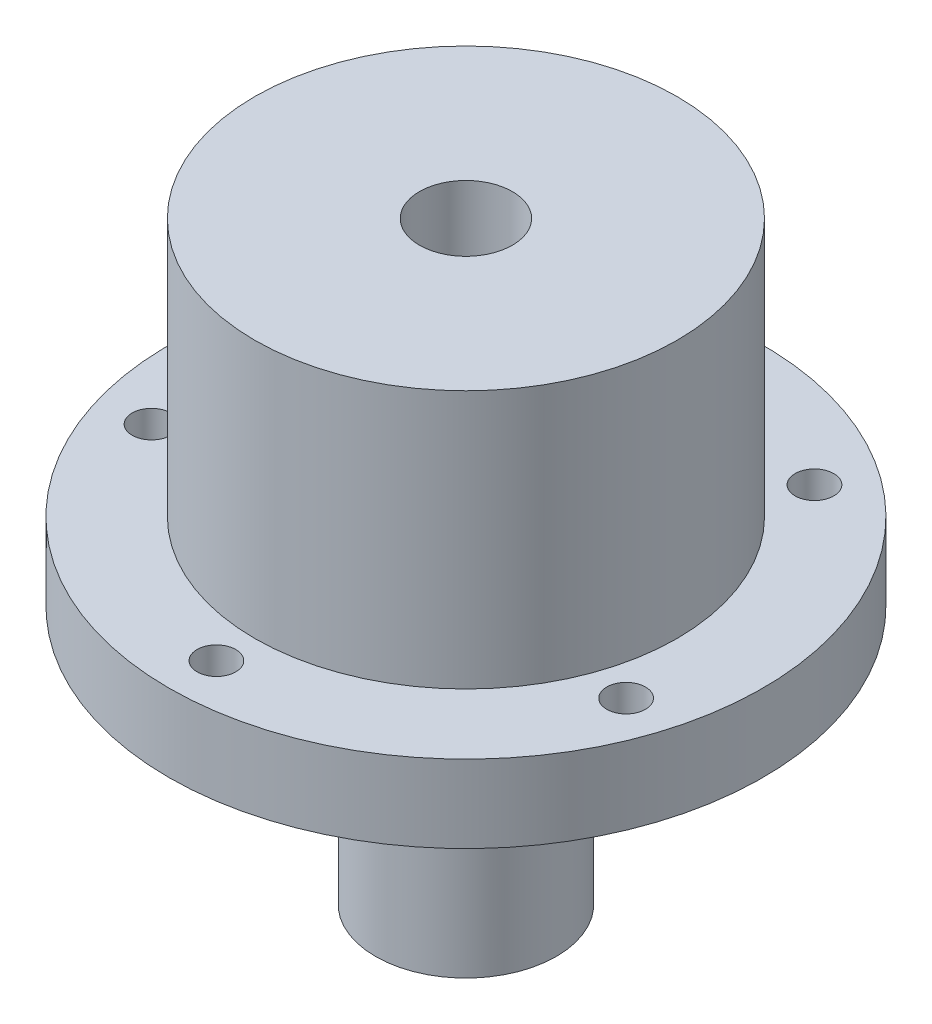
from build123d import *

# Parameters (mm, degrees)
BOSS_EXTRUDE1_DEPTH      = 10
BOSS_EXTRUDE1_DEPTH_BACK = 3
SKETCH1_R                = 8.175
SKETCH1_R_2              = 1.8
SKETCH1_3_R              = 11.5
SKETCH1_3_R_2            = 8.175
BOSS_EXTRUDE2_DEPTH      = 3
SKETCH2_R                = 1.25
CUT_EXTRUDE1_DEPTH       = 15
SKETCH4_R                = 3.5
BOSS_EXTRUDE3_DEPTH      = 10
SKETCH1_7_R              = 1.8
CUT_EXTRUDE2_DEPTH       = 13
SKETCH3_R                = 0.75
CUT_EXTRUDE3_DEPTH       = 10


with BuildPart() as part:
    # Sketch1 → Boss-Extrude1 (new, two sides: drawn at the far end of the back side and taken through both)
    with BuildSketch(Plane(origin=(0, 0, 0), x_dir=(1, 0, 0), z_dir=(0, 1, 0)).offset(-BOSS_EXTRUDE1_DEPTH_BACK)):
        Circle(SKETCH1_R)
        Circle(SKETCH1_R_2, mode=Mode.SUBTRACT)
    extrude(amount=BOSS_EXTRUDE1_DEPTH + BOSS_EXTRUDE1_DEPTH_BACK)

    # Sketch2 → Cut-Extrude1 (cut)
    with BuildSketch(Plane(origin=(0, 0, 0), x_dir=(0, 0, -1), z_dir=(1, 0, 0))):
        with Locations((0, 4.702908986)):
            Circle(SKETCH2_R)
    extrude(amount=-CUT_EXTRUDE1_DEPTH, mode=Mode.SUBTRACT)


with BuildPart() as body_2:
    # Sketch1<3> → Boss-Extrude2 (new body)
    with BuildSketch(Plane(origin=(0, 0, 0), x_dir=(1, 0, 0), z_dir=(0, 1, 0))):
        Circle(SKETCH1_3_R)
        Circle(SKETCH1_3_R_2, mode=Mode.SUBTRACT)
    extrude(amount=-BOSS_EXTRUDE2_DEPTH)


    add(part.part)  # Boss-Extrude3 merges part
    # Sketch4 → Boss-Extrude3 (add)
    with BuildSketch(Plane.XZ.offset(3)):
        Circle(SKETCH4_R)
    extrude(amount=BOSS_EXTRUDE3_DEPTH)

    # Sketch1<7> → Cut-Extrude2 (cut)
    with BuildSketch(Plane(origin=(0, 0, 0), x_dir=(1, 0, 0), z_dir=(0, 1, 0))):
        Circle(SKETCH1_7_R)
    extrude(amount=-CUT_EXTRUDE2_DEPTH, mode=Mode.SUBTRACT)

    # Sketch3 → Cut-Extrude3 (cut)
    with BuildSketch(Plane.XZ.offset(3)):
        with Locations((0, 9.661253085)):
            Circle(SKETCH3_R)
        with Locations((9.188397702, 2.98549139)):
            Circle(SKETCH3_R)
        with Locations((5.678742082, -7.816117933)):
            Circle(SKETCH3_R)
        with Locations((-5.678742082, -7.816117933)):
            Circle(SKETCH3_R)
        with Locations((-9.188397702, 2.98549139)):
            Circle(SKETCH3_R)
    extrude(amount=-CUT_EXTRUDE3_DEPTH, mode=Mode.SUBTRACT)


solid = body_2.part
